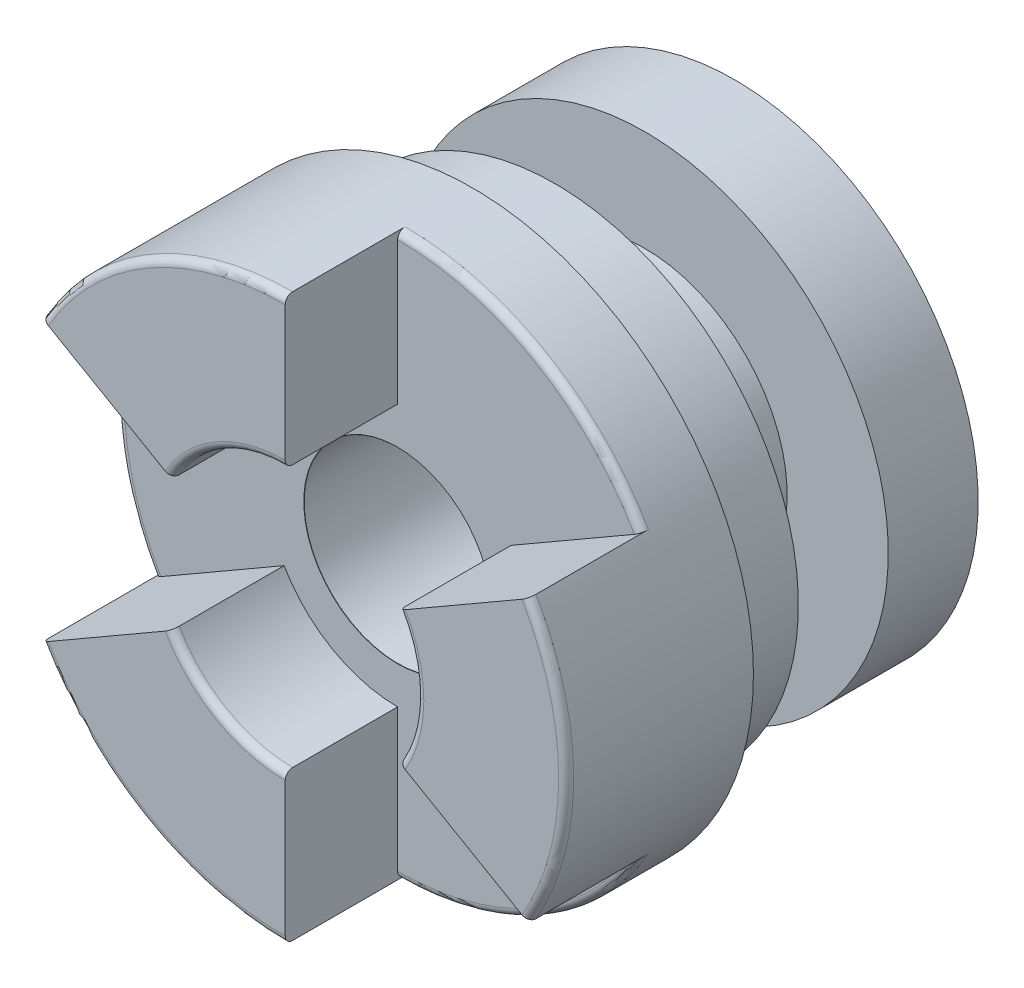
from build123d import *

# Parameters (mm, degrees)
SKETCH1_R                        = 37.5
BOSS_EXTRUDE1_DEPTH              = 10
SKETCH2_R                        = 32.5
BOSS_EXTRUDE2_DEPTH              = 11
SKETCH3_R                        = 19
BOSS_EXTRUDE3_DEPTH              = 12
SKETCH4_R                        = 32.5
BOSS_EXTRUDE4_DEPTH              = 12
BOSS_EXTRUDE5_DEPTH              = 15
FILLET1_R                        = 1
F_25_0MM_DOWEL_HOLE1_D           = 25
F_25_0MM_DOWEL_HOLE1_CSINK_D     = 25.05
F_25_0MM_DOWEL_HOLE1_CSINK_ANGLE = 90
SKETCH9_W                        = 15.8
SKETCH9_H                        = 44.975
CUT_EXTRUDE2_DEPTH               = 4.25
CUT_EXTRUDE3_DEPTH               = 4.25


with BuildPart() as part:
    # Sketch1 → Boss-Extrude1 (new body)
    with BuildSketch(Plane.XY):
        Circle(SKETCH1_R)
    extrude(amount=BOSS_EXTRUDE1_DEPTH)

    # Sketch2 → Boss-Extrude2 (add)
    with BuildSketch(Plane(origin=(0, 0, 0), x_dir=(-1, 0, 0), z_dir=(0, 0, -1))):
        Circle(SKETCH2_R)
    extrude(amount=BOSS_EXTRUDE2_DEPTH)

    # Sketch3 → Boss-Extrude3 (add)
    with BuildSketch(Plane(origin=(0, 0, -11), x_dir=(-1, 0, 0), z_dir=(0, 0, -1))):
        Circle(SKETCH3_R)
    extrude(amount=BOSS_EXTRUDE3_DEPTH)

    # Sketch4 → Boss-Extrude4 (add)
    with BuildSketch(Plane(origin=(0, 0, -23), x_dir=(-1, 0, 0), z_dir=(0, 0, -1))):
        Circle(SKETCH4_R)
    extrude(amount=BOSS_EXTRUDE4_DEPTH)

    # Sketch5 → Boss-Extrude5 (add)
    with BuildSketch(Plane.XY.offset(10)):
        with BuildLine():
            Line((0, 17.5), (0, 37.5))
            ThreePointArc((0, 37.5), (-18.75, 32.475952642), (-32.475952642, 18.75))
            Line((-32.475952642, 18.75), (-15.155444566, 8.75))
            ThreePointArc((-15.155444566, 8.75), (-8.75, 15.155444566), (0, 17.5))
        make_face()
        with BuildLine():
            Line((-15.155444566, -8.75), (-32.475952642, -18.75))
            ThreePointArc((-32.475952642, -18.75), (-18.75, -32.475952642), (0, -37.5))
            Line((0, -37.5), (0, -17.5))
            ThreePointArc((0, -17.5), (-8.75, -15.155444566), (-15.155444566, -8.75))
        make_face()
        with BuildLine():
            ThreePointArc((37.5, 0), (36.222218486, 9.705714191), (32.475952642, 18.75))
            Line((32.475952642, 18.75), (15.155444566, 8.75))
            ThreePointArc((15.155444566, 8.75), (16.90370196, 4.529333289), (17.5, 0))
            ThreePointArc((17.5, 0), (16.90370196, -4.529333289), (15.155444566, -8.75))
            Line((15.155444566, -8.75), (32.475952642, -18.75))
            ThreePointArc((32.475952642, -18.75), (36.222218486, -9.705714191), (37.5, 0))
        make_face()
    extrude(amount=BOSS_EXTRUDE5_DEPTH)

    # Fillet1
    # the kernel refuses this fillet: 1 mm, written as the material it takes off along each edge
    with BuildSketch(Plane(origin=(0, 0, 10), x_dir=(-0.8660254037844362, 0.5000000000000042, 0), z_dir=(0.5000000000000042, 0.8660254037844362, 0))) as fillet1_piece_1:
        with BuildLine():
            CenterArc((37.5 - FILLET1_R, -FILLET1_R), FILLET1_R, 0, 90)
            Line((37.5 - FILLET1_R, 0), (37.5, 0))
            Line((37.5, 0), (37.5, -FILLET1_R))
        make_face()
    revolve(axis=Axis((0, 0, 10), (0, 0, 1)), revolution_arc=60, mode=Mode.SUBTRACT)
    with BuildSketch(Plane(origin=(0, 0, 25), x_dir=(-0.9283987696572769, 0.37158542019144725, 0), z_dir=(-0.37158542019144725, -0.9283987696572769, 0))) as fillet1_piece_2:
        with BuildLine():
            CenterArc((17.5 + FILLET1_R, FILLET1_R), FILLET1_R, 180, 90)
            Line((17.5 + FILLET1_R, 0), (17.5, 0))
            Line((17.5, 0), (17.5, FILLET1_R))
        make_face()
    revolve(axis=Axis((0, 0, 25), (0, 0, -1)), revolution_arc=76.373144951, mode=Mode.SUBTRACT)
    with BuildSketch(Plane(origin=(0, 0, 25), x_dir=(0.06662916908749308, 0.9977778078443669, 0), z_dir=(0.9977778078443669, -0.06662916908749308, 0))) as fillet1_piece_3:
        with BuildLine():
            CenterArc((37.5 - FILLET1_R, -FILLET1_R), FILLET1_R, 0, 90)
            Line((37.5 - FILLET1_R, 0), (37.5, 0))
            Line((37.5, 0), (37.5, -FILLET1_R))
        make_face()
    revolve(axis=Axis((0, 0, 25), (0, 0, 1)), revolution_arc=67.640800977, mode=Mode.SUBTRACT)
    with BuildSketch(Plane(origin=(0, 0, 10), x_dir=(0, -1, 0), z_dir=(-1, 0, 0))) as fillet1_piece_4:
        with BuildLine():
            CenterArc((37.5 - FILLET1_R, -FILLET1_R), FILLET1_R, 0, 90)
            Line((37.5 - FILLET1_R, 0), (37.5, 0))
            Line((37.5, 0), (37.5, -FILLET1_R))
        make_face()
    revolve(axis=Axis((0, 0, 10), (0, 0, 1)), revolution_arc=60, mode=Mode.SUBTRACT)
    with BuildSketch(Plane(origin=(0, 0, 25), x_dir=(0.14239697126692002, -0.9898096294611445, 0), z_dir=(0.9898096294611445, 0.14239697126692002, 0))) as fillet1_piece_5:
        with BuildLine():
            CenterArc((17.5 + FILLET1_R, FILLET1_R), FILLET1_R, 180, 90)
            Line((17.5 + FILLET1_R, 0), (17.5, 0))
            Line((17.5, 0), (17.5, FILLET1_R))
        make_face()
    revolve(axis=Axis((0, 0, 25), (0, 0, -1)), revolution_arc=76.373144951, mode=Mode.SUBTRACT)
    with BuildSketch(Plane(origin=(0, 0, 25), x_dir=(-0.8974155134693206, -0.44118635085935703, 0), z_dir=(-0.44118635085935703, 0.8974155134693206, 0))) as fillet1_piece_6:
        with BuildLine():
            CenterArc((37.5 - FILLET1_R, -FILLET1_R), FILLET1_R, 0, 90)
            Line((37.5 - FILLET1_R, 0), (37.5, 0))
            Line((37.5, 0), (37.5, -FILLET1_R))
        make_face()
    revolve(axis=Axis((0, 0, 25), (0, 0, 1)), revolution_arc=67.640800977, mode=Mode.SUBTRACT)
    with BuildSketch(Plane(origin=(0, 0, 10), x_dir=(0.8660254037844433, 0.49999999999999195, 0), z_dir=(0.49999999999999195, -0.8660254037844433, 0))) as fillet1_piece_7:
        with BuildLine():
            CenterArc((37.5 - FILLET1_R, -FILLET1_R), FILLET1_R, 0, 90)
            Line((37.5 - FILLET1_R, 0), (37.5, 0))
            Line((37.5, 0), (37.5, -FILLET1_R))
        make_face()
    revolve(axis=Axis((0, 0, 10), (0, 0, 1)), revolution_arc=60, mode=Mode.SUBTRACT)
    with BuildSketch(Plane(origin=(0, 0, 25), x_dir=(0.7860017983903416, -0.6182242092697025, 0), z_dir=(-0.6182242092697025, -0.7860017983903416, 0))) as fillet1_piece_8:
        with BuildLine():
            CenterArc((17.5 + FILLET1_R, -FILLET1_R), FILLET1_R, 90, 90)
            Line((17.5, -FILLET1_R), (17.5, 0))
            Line((17.5, 0), (17.5 + FILLET1_R, 0))
        make_face()
    revolve(axis=Axis((0, 0, 25), (0, 0, 1)), revolution_arc=76.373144951, mode=Mode.SUBTRACT)
    with BuildSketch(Plane(origin=(0, 0, 25), x_dir=(0.8307863443818282, 0.5565914569849941, 0), z_dir=(-0.5565914569849941, 0.8307863443818282, 0))) as fillet1_piece_9:
        with BuildLine():
            CenterArc((37.5 - FILLET1_R, FILLET1_R), FILLET1_R, 270, 90)
            Line((37.5 - FILLET1_R, 0), (37.5, 0))
            Line((37.5, 0), (37.5, FILLET1_R))
        make_face()
    revolve(axis=Axis((0, 0, 25), (0, 0, -1)), revolution_arc=67.640800977, mode=Mode.SUBTRACT)

    # Ø25.0mm Dowel Hole1 (through all)
    with Locations(Plane.XY.offset(10)):
        with Locations((0, 0)):
            CounterSinkHole(F_25_0MM_DOWEL_HOLE1_D / 2, F_25_0MM_DOWEL_HOLE1_CSINK_D / 2, counter_sink_angle=F_25_0MM_DOWEL_HOLE1_CSINK_ANGLE)

    # Sketch9 → Cut-Extrude2 (cut, symmetric)
    with BuildSketch(Plane(origin=(0, 0, 0), x_dir=(1, 0, 0), z_dir=(0, 1, 0))):
        with Locations((7.9, 12.5125)):
            Rectangle(SKETCH9_W, SKETCH9_H)
    extrude(amount=CUT_EXTRUDE2_DEPTH, both=True, mode=Mode.SUBTRACT)

    # Sketch12 → Cut-Extrude3 (cut, symmetric)
    with BuildSketch(Plane(origin=(0, 0, 9.975), x_dir=(-1, 0, 0), z_dir=(0, 0, -1))):
        with BuildLine():
            Line((-11.755317946, 4.25), (-15.8, 4.25))
            Line((-15.8, 4.25), (-15.8, -4.25))
            Line((-15.8, -4.25), (-11.755317946, -4.25))
            ThreePointArc((-11.755317946, -4.25), (-12.5, 0), (-11.755317946, 4.25))
        make_face()
    extrude(amount=CUT_EXTRUDE3_DEPTH, both=True, mode=Mode.SUBTRACT)


solid = part.part
